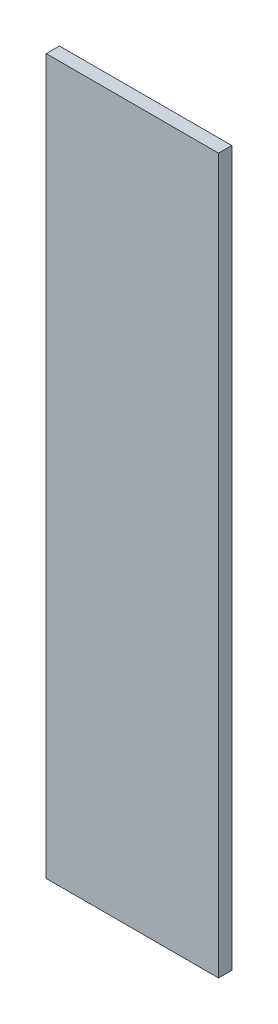
from build123d import *

# Parameters (mm, degrees)
ESQUISSE1_W        = 65.121094869
ESQUISSE1_H        = 270
BOSS_EXTRU_1_DEPTH = 5


with BuildPart() as part:
    # Esquisse1 → Boss.-Extru.1 (new body)
    with BuildSketch(Plane.XY):
        with Locations((32.560547435, 135)):
            Rectangle(ESQUISSE1_W, ESQUISSE1_H)
    extrude(amount=-BOSS_EXTRU_1_DEPTH)


solid = part.part
